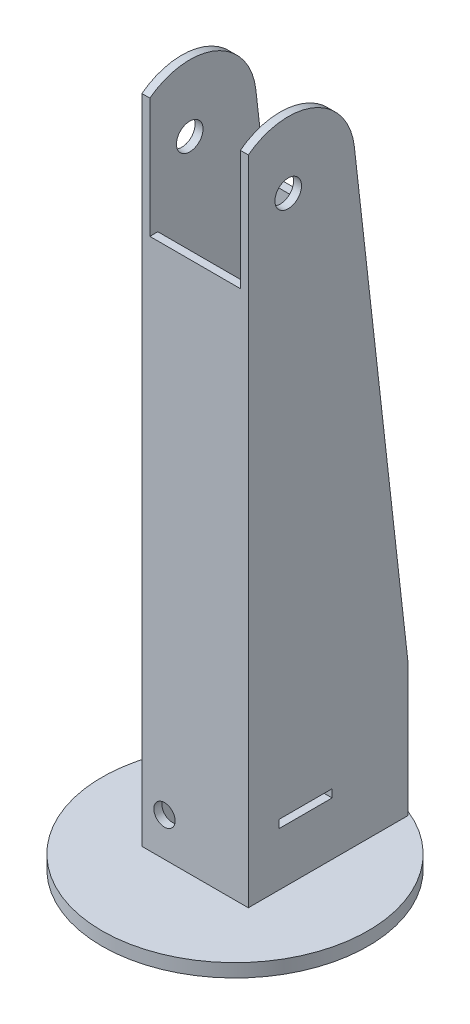
from build123d import *

# Parameters (mm, degrees)
CROQUIS1_W              = 40
CROQUIS1_H              = 60
SALIENTE_EXTRUIR1_DEPTH = 250
CROQUIS2_W              = 34
CROQUIS2_H              = 60
CORTAR_EXTRUIR1_DEPTH   = 50
CROQUIS3_R              = 5
CORTAR_EXTRUIR2_DEPTH   = 255.95097568
CORTAR_EXTRUIR5_DEPTH   = 255.95097568
CROQUIS6_R              = 50
SALIENTE_EXTRUIR2_DEPTH = 5
CROQUIS7_W              = 34
CROQUIS7_H              = 37
CORTAR_EXTRUIR6_DEPTH   = 221.794021658
CROQUIS8_R              = 4
CORTAR_EXTRUIR7_DEPTH   = 273.075357208
CROQUIS10_W             = 20
CROQUIS10_H             = 3
CORTAR_EXTRUIR8_DEPTH   = 268.628473821


with BuildPart() as part:
    # Croquis1 → Saliente-Extruir1 (new body)
    with BuildSketch(Plane(origin=(0, 0, 0), x_dir=(1, 0, 0), z_dir=(0, 1, 0))):
        Rectangle(CROQUIS1_W, CROQUIS1_H)
    extrude(amount=SALIENTE_EXTRUIR1_DEPTH)

    # Croquis2 → Cortar-Extruir1 (cut)
    with BuildSketch(Plane(origin=(0, 250, 0), x_dir=(1, 0, 0), z_dir=(0, 1, 0))):
        Rectangle(CROQUIS2_W, CROQUIS2_H)
    extrude(amount=-CORTAR_EXTRUIR1_DEPTH, mode=Mode.SUBTRACT)

    # Croquis3 → Cortar-Extruir2 (cut, through all)
    with BuildSketch(Plane(origin=(20, 0, 0), x_dir=(0, 0, -1), z_dir=(1, 0, 0))):
        with Locations((-15, 225)):
            Circle(CROQUIS3_R)
    extrude(amount=-CORTAR_EXTRUIR2_DEPTH, mode=Mode.SUBTRACT)

    # Croquis5 → Cortar-Extruir5 (cut, through all)
    with BuildSketch(Plane(origin=(20, 0, 0), x_dir=(0, 0, -1), z_dir=(1, 0, 0))):
        with BuildLine():
            ThreePointArc((-30, 245), (-22.905694203, 248.717082434), (-15.00000011, 250))
            Line((-15.00000011, 250), (-30, 250))
            Line((-30, 250), (-30, 245))
        make_face()
        with BuildLine():
            Line((9.840871205, 227.816224024), (30, 50))
            Line((30, 50), (30, 250))
            Line((30, 250), (-15.00000011, 250))
            ThreePointArc((-15.00000011, 250), (1.652243042, 243.646790653), (9.840871205, 227.816224024))
        make_face()
    extrude(amount=-CORTAR_EXTRUIR5_DEPTH, mode=Mode.SUBTRACT)

    # Croquis6 → Saliente-Extruir2 (add)
    with BuildSketch(Plane.XZ):
        with Locations((0, 15)):
            Circle(CROQUIS6_R)
    extrude(amount=SALIENTE_EXTRUIR2_DEPTH)

    # Croquis7 → Cortar-Extruir6 (cut, through all)
    with BuildSketch(Plane(origin=(0, 200, 0), x_dir=(1, 0, 0), z_dir=(0, 1, 0))):
        with Locations((0, -8.5)):
            Rectangle(CROQUIS7_W, CROQUIS7_H)
    extrude(amount=-CORTAR_EXTRUIR6_DEPTH, mode=Mode.SUBTRACT)

    # Croquis8 → Cortar-Extruir7 (cut, through all)
    with BuildSketch(Plane(origin=(0, 0, -30), x_dir=(-1, 0, 0), z_dir=(0, 0, -1))):
        with Locations((11.5, 14.5)):
            Circle(CROQUIS8_R)
    extrude(amount=-CORTAR_EXTRUIR7_DEPTH, mode=Mode.SUBTRACT)

    # Croquis10 → Cortar-Extruir8 (cut, through all)
    with BuildSketch(Plane.ZY.offset(20)):
        with Locations((8.5, 21.5)):
            Rectangle(CROQUIS10_W, CROQUIS10_H)
    extrude(amount=-CORTAR_EXTRUIR8_DEPTH, mode=Mode.SUBTRACT)


solid = part.part
